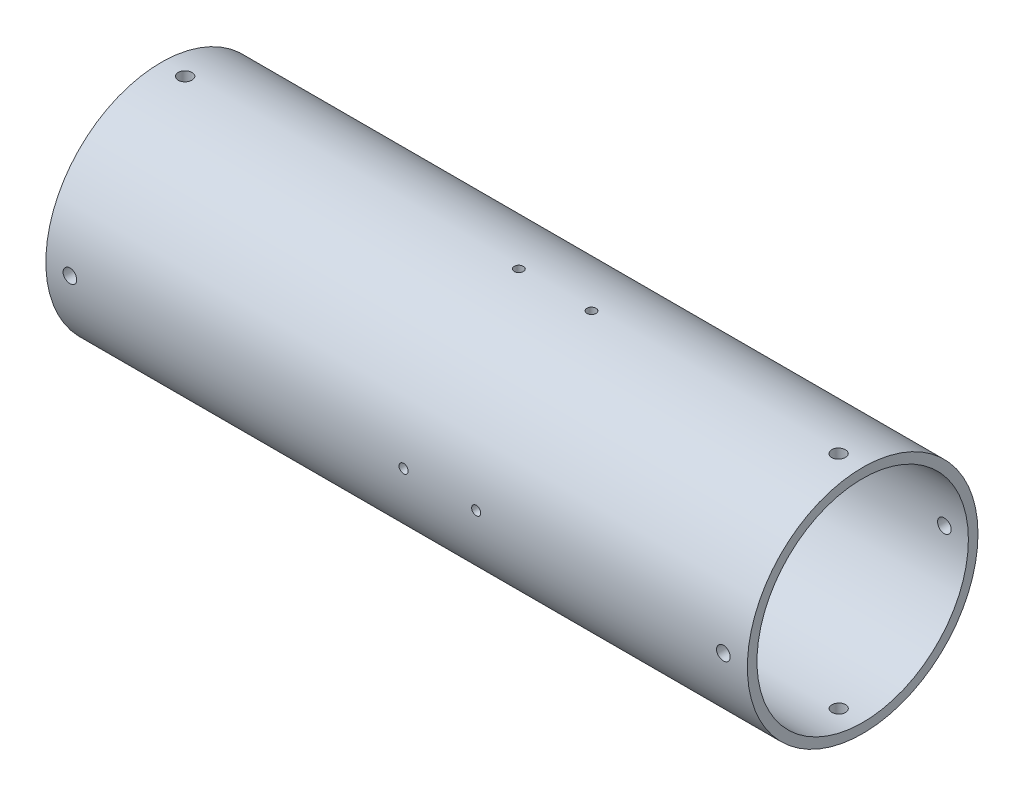
from build123d import *

# Parameters (mm, degrees)
SKETCH2_R                  = 38.1
SKETCH2_R_2                = 34.925
BOSS_EXTRUDE1_DEPTH        = 115.8875
SKETCH3_R                  = 1.5
CUT_EXTRUDE1_DEPTH         = 4.5
CIRPATTERN1_COUNT          = 3
CIRPATTERN1_ANGLE          = 180
SKETCH5_W                  = 18
SKETCH5_H                  = 24
CUT_EXTRUDE3_DEPTH         = 15.5
MIRROR1_COPY_1_SKETCH_R    = 1.5
MIRROR1_COPY_1_DEPTH       = 4.5
MIRROR1_COPY_2_SKETCH_R    = 1.5
MIRROR1_COPY_2_DEPTH       = 4.5
SKETCH6_W                  = 12
SKETCH6_H                  = 17.971550642
CUT_EXTRUDE4_DEPTH         = 19
FILLET1_R                  = 5
FILLET2_R                  = 1.5
F_8_CLEARANCE_HOLE1_REACH  = 241.502
F_8_CLEARANCE_HOLE1_BORE_R = 2.2479
CIRPATTERN2_COUNT          = 4
MIRROR2_COPY_1_REACH       = 241.502
MIRROR2_COPY_1_SKETCH_R    = 2.2479
MIRROR2_COPY_2_REACH       = 241.502
MIRROR2_COPY_2_SKETCH_R    = 2.2479
MIRROR2_COPY_3_REACH       = 241.502
MIRROR2_COPY_3_SKETCH_R    = 2.2479


with BuildPart() as part:
    # Sketch2 → Boss-Extrude1 (new, symmetric)
    with BuildSketch(Plane(origin=(0, 0, 0), x_dir=(0, 0, -1), z_dir=(1, 0, 0))):
        Circle(SKETCH2_R)
        Circle(SKETCH2_R_2, mode=Mode.SUBTRACT)
    extrude(amount=BOSS_EXTRUDE1_DEPTH, both=True)

    # Sketch3 → Cut-Extrude1 (cut)
    with BuildSketch(Plane(origin=(0, 38.1, 0), x_dir=(1, 0, 0), z_dir=(0, 1, 0))):
        with Locations(Location((2.2875, 0, 0), (0, 0, 270))):
            Circle(SKETCH3_R)
    cut_extrude1 = extrude(amount=-CUT_EXTRUDE1_DEPTH, mode=Mode.SUBTRACT)

    # CirPattern1: Cut-Extrude1 ×3 about axis
    cirpattern1_axis = Axis((115.8875, 0, 0), (1, 0, 0))
    for i in range(1, CIRPATTERN1_COUNT):
        add(cut_extrude1.rotate(cirpattern1_axis, i * CIRPATTERN1_ANGLE / (CIRPATTERN1_COUNT - 1)), mode=Mode.SUBTRACT)

    # Sketch5 → Cut-Extrude3 (cut)
    with BuildSketch(Plane(origin=(0, -20.189923967, -32.310632464), x_dir=(-1, 0, 0), z_dir=(0, -0.529919264233203, -0.8480480961564272))):
        with Locations((0.7125, 0)):
            Rectangle(SKETCH5_W, SKETCH5_H)
    cut_extrude3 = extrude(amount=-CUT_EXTRUDE3_DEPTH, mode=Mode.SUBTRACT)

    # Mirror1: Cut-Extrude1, Cut-Extrude3 across plane
    add(cut_extrude1.mirror(Plane(origin=(14.2875, 0, 0), x_dir=(0, 0, 1), z_dir=(1, 0, 0))), mode=Mode.SUBTRACT)
    add(cut_extrude3.mirror(Plane(origin=(14.2875, 0, 0), x_dir=(0, 0, 1), z_dir=(1, 0, 0))), mode=Mode.SUBTRACT)

    # Mirror1 copy 1 sketch → Mirror1 copy 1 (cut)
    with BuildSketch(Plane(origin=(28.575, 0, 38.1), x_dir=(-1, 0, 0), z_dir=(0, 0, 1))):
        with Locations((2.2875, 0)):
            Circle(MIRROR1_COPY_1_SKETCH_R)
    extrude(amount=-MIRROR1_COPY_1_DEPTH, mode=Mode.SUBTRACT)

    # Mirror1 copy 2 sketch → Mirror1 copy 2 (cut)
    with BuildSketch(Plane(origin=(28.575, -38.1, 0), x_dir=(-1, 0, 0), z_dir=(0, -1, 0))):
        with Locations((2.2875, 0)):
            Circle(MIRROR1_COPY_2_SKETCH_R)
    extrude(amount=-MIRROR1_COPY_2_DEPTH, mode=Mode.SUBTRACT)

    # Sketch6 → Cut-Extrude4 (cut)
    with BuildSketch(Plane(origin=(0, 0, -38.1), x_dir=(-1, 0, 0), z_dir=(0, 0, -1))):
        with Locations((-5.2875, 0)):
            Rectangle(SKETCH6_W, SKETCH6_H)
    extrude(amount=-CUT_EXTRUDE4_DEPTH, mode=Mode.SUBTRACT)

    # Fillet1
    fillet1_edges = [part.edges().sort_by_distance(p)[0] for p in [
        (8.2875, -28.448088526, -22.881499376),
        (-9.7125, -8.094934218, -35.599561717),
        (-9.7125, -28.448088526, -22.881499376),
        (20.2875, -8.094934218, -35.599561717),
        (20.2875, -28.448088526, -22.881499376),
        (38.2875, -28.448088526, -22.881499376),
        (38.2875, -8.094934218, -35.599561717),
    ]]
    fillet(fillet1_edges, radius=FILLET1_R)

    # Fillet2
    fillet2_edges = [part.edges().sort_by_distance(p)[0] for p in [
        (11.2875, 8.985775321, -35.38722472),
        (-0.7125, 8.985775321, -35.38722472),
        (11.2875, -8.985775321, -35.38722472),
        (-0.7125, -8.094934218, -35.599561717),
        (8.2875, -8.985775321, -35.38722472),
    ]]
    fillet(fillet2_edges, radius=FILLET2_R - 0.0001)  # a hair under: the kernel refuses the full size

    # #8 Clearance Hole1 bore (on position points) → #8 Clearance Hole1 (cut, up to next)
    with BuildSketch(Plane(origin=(107.95, 0, 38.1), x_dir=(1, 0, 0), z_dir=(0, 0, 1)), mode=Mode.PRIVATE) as f_8_clearance_hole1_sk1:
        Circle(F_8_CLEARANCE_HOLE1_BORE_R)
    f_8_clearance_hole1_tool1 = extrude(f_8_clearance_hole1_sk1.sketch, amount=-F_8_CLEARANCE_HOLE1_REACH, mode=Mode.PRIVATE) & part.part
    f_8_clearance_hole1 = f_8_clearance_hole1_tool1.solids().sort_by_distance((107.95, 0, 38.1))[0]
    add(f_8_clearance_hole1, mode=Mode.SUBTRACT)

    # CirPattern2: #8 Clearance Hole1 ×4 about axis
    cirpattern2_axis = Axis((115.8875, 0, 0), (-1, 0, 0))
    for i in range(1, CIRPATTERN2_COUNT):
        add(f_8_clearance_hole1.rotate(cirpattern2_axis, i * 360 / CIRPATTERN2_COUNT), mode=Mode.SUBTRACT)

    # Mirror2: #8 Clearance Hole1 across plane
    add(f_8_clearance_hole1.mirror(Plane(origin=(0, 0, 0), x_dir=(0, 0, 1), z_dir=(1, 0, 0))), mode=Mode.SUBTRACT)

    # Mirror2 copy 1 sketch → Mirror2 copy 1 (cut, up to next)
    with BuildSketch(Plane(origin=(-107.95, 38.1, 0), x_dir=(-1, 0, 0), z_dir=(0, 1, 0)), mode=Mode.PRIVATE) as mirror2_copy_1_sk1:
        Circle(MIRROR2_COPY_1_SKETCH_R)
    mirror2_copy_1_tool1 = extrude(mirror2_copy_1_sk1.sketch, amount=-MIRROR2_COPY_1_REACH, mode=Mode.PRIVATE) & part.part
    add(mirror2_copy_1_tool1.solids().sort_by_distance((-107.95, 38.1, 0))[0], mode=Mode.SUBTRACT)

    # Mirror2 copy 2 sketch → Mirror2 copy 2 (cut, up to next)
    with BuildSketch(Plane(origin=(-107.95, 0, -38.1), x_dir=(-1, 0, 0), z_dir=(0, 0, -1)), mode=Mode.PRIVATE) as mirror2_copy_2_sk1:
        Circle(MIRROR2_COPY_2_SKETCH_R)
    mirror2_copy_2_tool1 = extrude(mirror2_copy_2_sk1.sketch, amount=-MIRROR2_COPY_2_REACH, mode=Mode.PRIVATE) & part.part
    add(mirror2_copy_2_tool1.solids().sort_by_distance((-107.95, 0, -38.1))[0], mode=Mode.SUBTRACT)

    # Mirror2 copy 3 sketch → Mirror2 copy 3 (cut, up to next)
    with BuildSketch(Plane(origin=(-107.95, -38.1, 0), x_dir=(-1, 0, 0), z_dir=(0, -1, 0)), mode=Mode.PRIVATE) as mirror2_copy_3_sk1:
        Circle(MIRROR2_COPY_3_SKETCH_R)
    mirror2_copy_3_tool1 = extrude(mirror2_copy_3_sk1.sketch, amount=-MIRROR2_COPY_3_REACH, mode=Mode.PRIVATE) & part.part
    add(mirror2_copy_3_tool1.solids().sort_by_distance((-107.95, -38.1, 0))[0], mode=Mode.SUBTRACT)


solid = part.part
